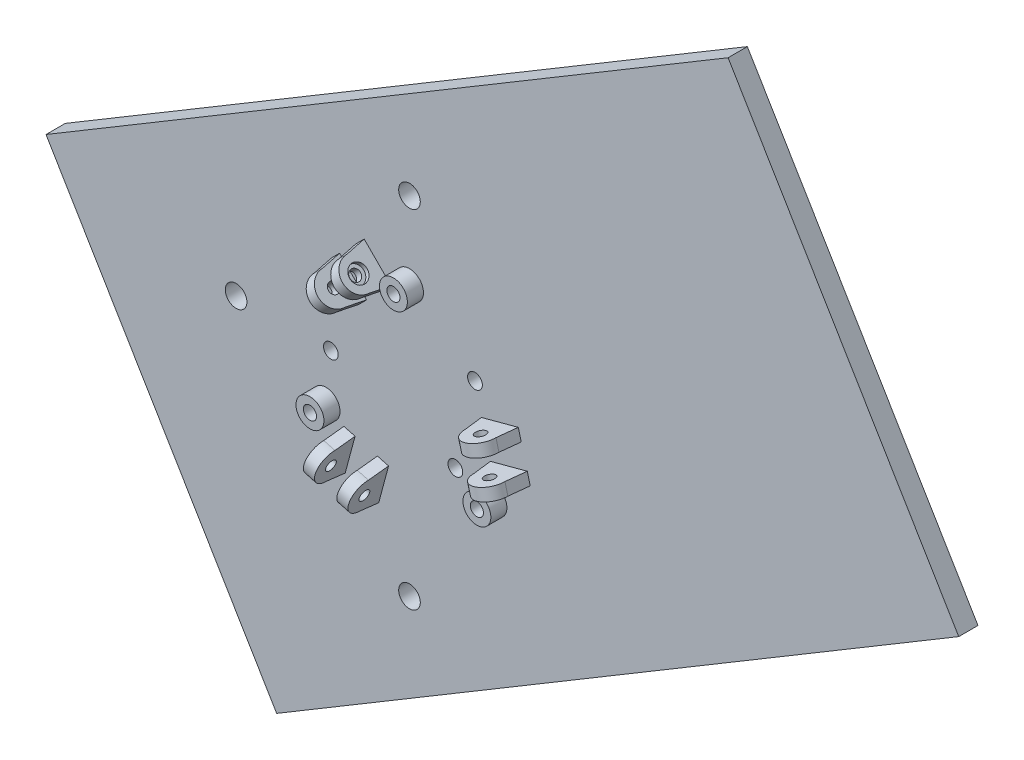
from build123d import *

# Parameters (mm, degrees)
F_01_START                                    = -12
S01_ROUNDED_V3_BACKPLATE_WITH_CAGE_AND_R      = 3.365102548
S01_ROUNDED_V3_BACKPLATE_WITH_CAGE_AND_R_2    = 2.294388101
F_01_ROUNDED_V3_BACKPLATE_WITH_CAGE_AND_DEPTH = 6
F_02_START                                    = -6
S02_THREE_CORD_GUIDE_PEDESTALS_R              = 4.35
F_02_THREE_CORD_GUIDE_PEDESTALS_DEPTH         = 5
F_03_START                                    = -13
S03_THREE_SMOOTH_GROMMET_SEATS_R              = 2.05
F_03_THREE_SMOOTH_GROMMET_SEATS_DEPTH         = 14
F_04_START                                    = -7.2
F_04_INTEGRAL_A1_FORK_CHEEK_L_DEPTH           = 3.6
F_05_START                                    = 3.6
F_05_INTEGRAL_A1_FORK_CHEEK_R_DEPTH           = 3.6
F_06_START                                    = -7.5
S06_A1_PIVOT_THROUGH_BOTH_CHEEKS_R            = 1.65
F_06_A1_PIVOT_THROUGH_BOTH_CHEEKS_DEPTH       = 15
F_07_START                                    = -7.3
S07_A1_RECESSED_PIVOT_SCREW_HEAD_R            = 2.7
F_07_A1_RECESSED_PIVOT_SCREW_HEAD_DEPTH       = 1.5
F_08_START                                    = -7.2
F_08_INTEGRAL_A2_FORK_CHEEK_L_DEPTH           = 3.6
F_09_START                                    = 3.6
F_09_INTEGRAL_A2_FORK_CHEEK_R_DEPTH           = 3.6
F_10_START                                    = -7.5
S10_A2_PIVOT_THROUGH_BOTH_CHEEKS_R            = 1.65
F_10_A2_PIVOT_THROUGH_BOTH_CHEEKS_DEPTH       = 15
F_11_START                                    = -7.3
S11_A2_RECESSED_PIVOT_SCREW_HEAD_R            = 2.7
F_11_A2_RECESSED_PIVOT_SCREW_HEAD_DEPTH       = 1.5
F_12_START                                    = -7.2
F_12_INTEGRAL_A3_FORK_CHEEK_L_DEPTH           = 3.6
F_13_START                                    = 3.6
F_13_INTEGRAL_A3_FORK_CHEEK_R_DEPTH           = 3.6
F_14_START                                    = -7.5
S14_A3_PIVOT_THROUGH_BOTH_CHEEKS_R            = 1.65
F_14_A3_PIVOT_THROUGH_BOTH_CHEEKS_DEPTH       = 15
F_15_START                                    = -7.3
S15_A3_RECESSED_PIVOT_SCREW_HEAD_R            = 2.7
F_15_A3_RECESSED_PIVOT_SCREW_HEAD_DEPTH       = 1.5


with BuildPart() as part:
    # S01 - Rounded V3 backplate with cage and cassette fixings → 01 - Rounded V3 backplate with cage and cassette fixings (new body)
    with BuildSketch(Plane.XY.offset(F_01_START)):
        Polygon((-113.163433478, 13.929728046), (41.356735424, 106.252625544), (99.189614728, 140.806684253), (170.996312782, 20.624330663), (113.163433478, -13.929728046), (-41.356735424, -106.252625544), align=None)
        with Locations((0, 54)):
            Circle(S01_ROUNDED_V3_BACKPLATE_WITH_CAGE_AND_R, mode=Mode.SUBTRACT)
        with Locations((-53.973473076, 0)):
            Circle(S01_ROUNDED_V3_BACKPLATE_WITH_CAGE_AND_R, mode=Mode.SUBTRACT)
        with Locations((0, -54)):
            Circle(S01_ROUNDED_V3_BACKPLATE_WITH_CAGE_AND_R, mode=Mode.SUBTRACT)
        with Locations((14.276192628, -12.236736538)):
            Circle(S01_ROUNDED_V3_BACKPLATE_WITH_CAGE_AND_R_2, mode=Mode.SUBTRACT)
        with Locations((20.394560897, 14.276192628)):
            Circle(S01_ROUNDED_V3_BACKPLATE_WITH_CAGE_AND_R_2, mode=Mode.SUBTRACT)
        with Locations((-24.473473076, 0)):
            Circle(S01_ROUNDED_V3_BACKPLATE_WITH_CAGE_AND_R_2, mode=Mode.SUBTRACT)
    extrude(amount=F_01_ROUNDED_V3_BACKPLATE_WITH_CAGE_AND_DEPTH)

    # S02 - Three cord guide pedestals → 02 - Three cord guide pedestals (add)
    with BuildSketch(Plane.XY.offset(F_02_START)):
        with Locations((25.980762114, -15)):
            Circle(S02_THREE_CORD_GUIDE_PEDESTALS_R)
        with Locations((0, 30)):
            Circle(S02_THREE_CORD_GUIDE_PEDESTALS_R)
        with Locations((-25.980762114, -15)):
            Circle(S02_THREE_CORD_GUIDE_PEDESTALS_R)
    extrude(amount=F_02_THREE_CORD_GUIDE_PEDESTALS_DEPTH)

    # S03 - Three smooth grommet seats → 03 - Three smooth grommet seats (cut)
    with BuildSketch(Plane.XY.offset(F_03_START)):
        with Locations((25.980762114, -15)):
            Circle(S03_THREE_SMOOTH_GROMMET_SEATS_R)
        with Locations((0, 30)):
            Circle(S03_THREE_SMOOTH_GROMMET_SEATS_R)
        with Locations((-25.980762114, -15)):
            Circle(S03_THREE_SMOOTH_GROMMET_SEATS_R)
    extrude(amount=F_03_THREE_SMOOTH_GROMMET_SEATS_DEPTH, mode=Mode.SUBTRACT)

    # S04 - Integral A1 fork cheek L → 04 - Integral A1 fork cheek L (add)
    with BuildSketch(Plane(origin=(2.009618943, -7.5, 0), x_dir=(0.9659258262890683, 0.25881904510252085, 0), z_dir=(-0.2588190451025208, 0.9659258262890682, 0)).offset(F_04_START)):
        with BuildLine():
            Line((35.077774789, 7), (22.877774789, 7))
            Line((22.877774789, 7), (24.027774789, 0))
            ThreePointArc((24.027774789, 0), (28.977774789, -4.95), (33.927774789, 0))
            Line((33.927774789, 0), (35.077774789, 7))
        make_face()
    extrude(amount=F_04_INTEGRAL_A1_FORK_CHEEK_L_DEPTH)

    # S05 - Integral A1 fork cheek R → 05 - Integral A1 fork cheek R (add)
    with BuildSketch(Plane(origin=(2.009618943, -7.5, 0), x_dir=(0.9659258262890683, 0.25881904510252085, 0), z_dir=(-0.2588190451025208, 0.9659258262890682, 0)).offset(F_05_START)):
        with BuildLine():
            Line((35.077774789, 7), (22.877774789, 7))
            Line((22.877774789, 7), (24.027774789, 0))
            ThreePointArc((24.027774789, 0), (28.977774789, -4.95), (33.927774789, 0))
            Line((33.927774789, 0), (35.077774789, 7))
        make_face()
    extrude(amount=F_05_INTEGRAL_A1_FORK_CHEEK_R_DEPTH)

    # S06 - A1 pivot through both cheeks → 06 - A1 pivot through both cheeks (cut)
    with BuildSketch(Plane(origin=(2.009618943, -7.5, 0), x_dir=(0.9659258262890683, 0.25881904510252085, 0), z_dir=(-0.2588190451025208, 0.9659258262890682, 0)).offset(F_06_START)):
        with Locations((28.977774789, 0)):
            Circle(S06_A1_PIVOT_THROUGH_BOTH_CHEEKS_R)
    extrude(amount=F_06_A1_PIVOT_THROUGH_BOTH_CHEEKS_DEPTH, mode=Mode.SUBTRACT)

    # S07 - A1 recessed pivot screw head → 07 - A1 recessed pivot screw head (cut)
    with BuildSketch(Plane(origin=(2.009618943, -7.5, 0), x_dir=(0.9659258262890683, 0.25881904510252085, 0), z_dir=(-0.2588190451025208, 0.9659258262890682, 0)).offset(F_07_START)):
        with Locations((28.977774789, 0)):
            Circle(S07_A1_RECESSED_PIVOT_SCREW_HEAD_R)
    extrude(amount=F_07_A1_RECESSED_PIVOT_SCREW_HEAD_DEPTH, mode=Mode.SUBTRACT)

    # S08 - Integral A2 fork cheek L → 08 - Integral A2 fork cheek L (add)
    with BuildSketch(Plane(origin=(5.490381057, 5.490381057, 0), x_dir=(-0.7071067811865475, 0.7071067811865477, 0), z_dir=(-0.7071067811865477, -0.7071067811865475, 0)).offset(F_08_START)):
        with BuildLine():
            Line((35.077774789, 7), (22.877774789, 7))
            Line((22.877774789, 7), (24.027774789, 0))
            ThreePointArc((24.027774789, 0), (28.977774789, -4.95), (33.927774789, 0))
            Line((33.927774789, 0), (35.077774789, 7))
        make_face()
    extrude(amount=F_08_INTEGRAL_A2_FORK_CHEEK_L_DEPTH)

    # S09 - Integral A2 fork cheek R → 09 - Integral A2 fork cheek R (add)
    with BuildSketch(Plane(origin=(5.490381057, 5.490381057, 0), x_dir=(-0.7071067811865475, 0.7071067811865477, 0), z_dir=(-0.7071067811865477, -0.7071067811865475, 0)).offset(F_09_START)):
        with BuildLine():
            Line((35.077774789, 7), (22.877774789, 7))
            Line((22.877774789, 7), (24.027774789, 0))
            ThreePointArc((24.027774789, 0), (28.977774789, -4.95), (33.927774789, 0))
            Line((33.927774789, 0), (35.077774789, 7))
        make_face()
    extrude(amount=F_09_INTEGRAL_A2_FORK_CHEEK_R_DEPTH)

    # S10 - A2 pivot through both cheeks → 10 - A2 pivot through both cheeks (cut)
    with BuildSketch(Plane(origin=(5.490381057, 5.490381057, 0), x_dir=(-0.7071067811865475, 0.7071067811865477, 0), z_dir=(-0.7071067811865477, -0.7071067811865475, 0)).offset(F_10_START)):
        with Locations((28.977774789, 0)):
            Circle(S10_A2_PIVOT_THROUGH_BOTH_CHEEKS_R)
    extrude(amount=F_10_A2_PIVOT_THROUGH_BOTH_CHEEKS_DEPTH, mode=Mode.SUBTRACT)

    # S11 - A2 recessed pivot screw head → 11 - A2 recessed pivot screw head (cut)
    with BuildSketch(Plane(origin=(5.490381057, 5.490381057, 0), x_dir=(-0.7071067811865475, 0.7071067811865477, 0), z_dir=(-0.7071067811865477, -0.7071067811865475, 0)).offset(F_11_START)):
        with Locations((28.977774789, 0)):
            Circle(S11_A2_RECESSED_PIVOT_SCREW_HEAD_R)
    extrude(amount=F_11_A2_RECESSED_PIVOT_SCREW_HEAD_DEPTH, mode=Mode.SUBTRACT)

    # S12 - Integral A3 fork cheek L → 12 - Integral A3 fork cheek L (add)
    with BuildSketch(Plane(origin=(-7.5, 2.009618943, 0), x_dir=(0, 0, -1), z_dir=(0.9659258262890683, -0.25881904510252113, 0)).offset(F_12_START)):
        with BuildLine():
            Line((7, -35.077774789), (7, -22.877774789))
            Line((7, -22.877774789), (0, -24.027774789))
            ThreePointArc((0, -24.027774789), (-4.95, -28.977774789), (0, -33.927774789))
            Line((0, -33.927774789), (7, -35.077774789))
        make_face()
    extrude(amount=F_12_INTEGRAL_A3_FORK_CHEEK_L_DEPTH)

    # S13 - Integral A3 fork cheek R → 13 - Integral A3 fork cheek R (add)
    with BuildSketch(Plane(origin=(-7.5, 2.009618943, 0), x_dir=(0, 0, -1), z_dir=(0.9659258262890683, -0.25881904510252113, 0)).offset(F_13_START)):
        with BuildLine():
            Line((7, -35.077774789), (7, -22.877774789))
            Line((7, -22.877774789), (0, -24.027774789))
            ThreePointArc((0, -24.027774789), (-4.95, -28.977774789), (0, -33.927774789))
            Line((0, -33.927774789), (7, -35.077774789))
        make_face()
    extrude(amount=F_13_INTEGRAL_A3_FORK_CHEEK_R_DEPTH)

    # S14 - A3 pivot through both cheeks → 14 - A3 pivot through both cheeks (cut)
    with BuildSketch(Plane(origin=(-7.5, 2.009618943, 0), x_dir=(0, 0, -1), z_dir=(0.9659258262890683, -0.25881904510252113, 0)).offset(F_14_START)):
        with Locations((0, -28.977774789)):
            Circle(S14_A3_PIVOT_THROUGH_BOTH_CHEEKS_R)
    extrude(amount=F_14_A3_PIVOT_THROUGH_BOTH_CHEEKS_DEPTH, mode=Mode.SUBTRACT)

    # S15 - A3 recessed pivot screw head → 15 - A3 recessed pivot screw head (cut)
    with BuildSketch(Plane(origin=(-7.5, 2.009618943, 0), x_dir=(0, 0, -1), z_dir=(0.9659258262890683, -0.25881904510252113, 0)).offset(F_15_START)):
        with Locations((0, -28.977774789)):
            Circle(S15_A3_RECESSED_PIVOT_SCREW_HEAD_R)
    extrude(amount=F_15_A3_RECESSED_PIVOT_SCREW_HEAD_DEPTH, mode=Mode.SUBTRACT)


solid = part.part
